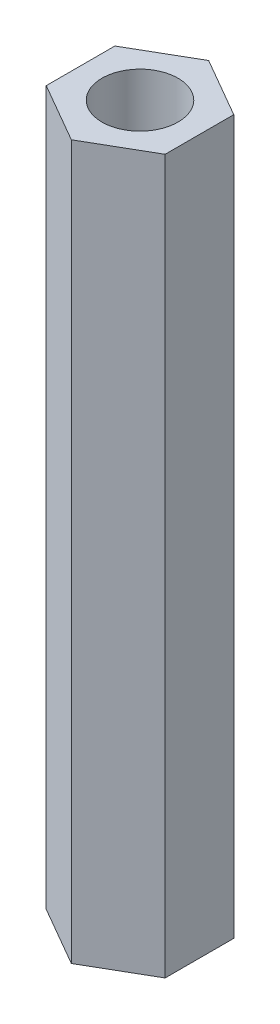
from build123d import *

# Parameters (mm, degrees)
SKETCH_1_R      = 1.6
EXTRUDE_1_DEPTH = 30


with BuildPart() as part:
    # 草图1 → 凸台-拉伸1 (new body)
    with BuildSketch(Plane(origin=(0, 0, 0), x_dir=(1, 0, 0), z_dir=(0, 1, 0))):
        Polygon((0, 2.886751346), (-2.5, 1.443375673), (-2.5, -1.443375673), (0, -2.886751346), (2.5, -1.443375673), (2.5, 1.443375673), align=None)
        Circle(SKETCH_1_R, mode=Mode.SUBTRACT)
    extrude(amount=EXTRUDE_1_DEPTH)


solid = part.part
